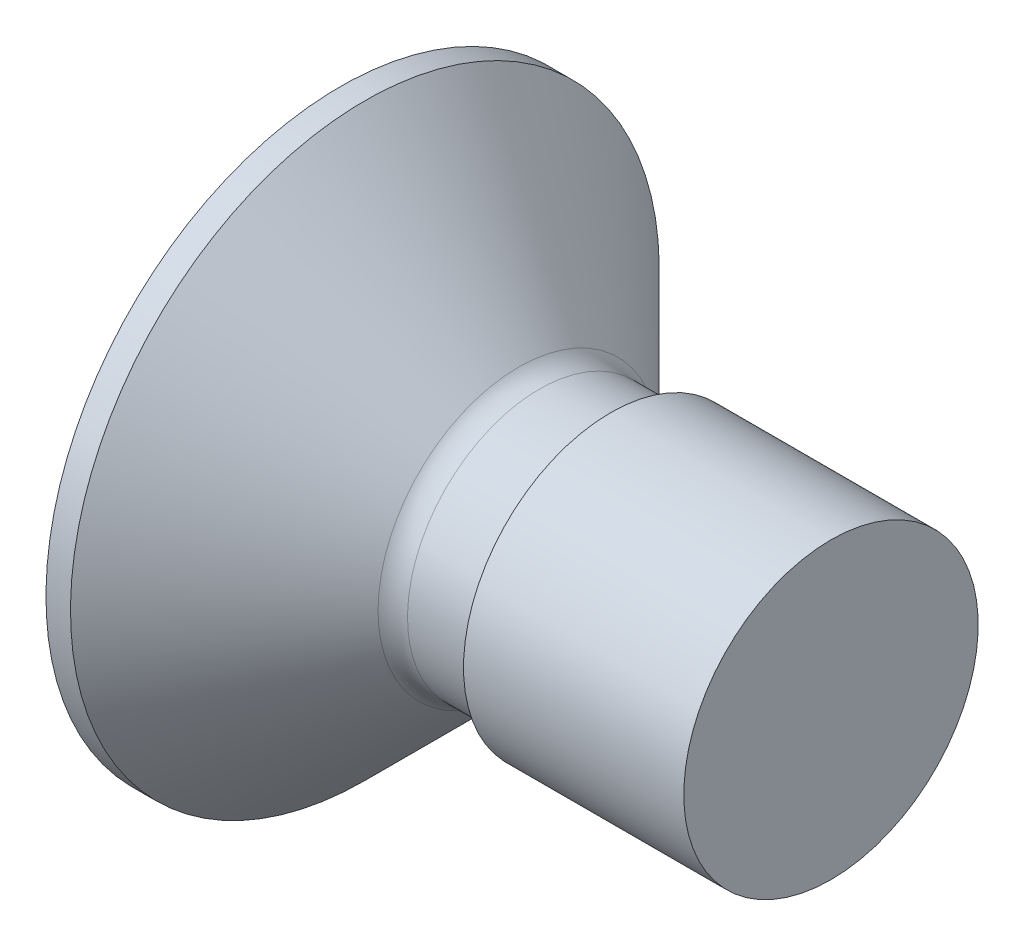
from build123d import *

# Parameters (mm, degrees)
FILLET1_R          = 0.3
CUT_EXTRUDE1_DEPTH = 0.88


with BuildPart() as part:
    # Sketch1 → Revolve1 (revolve)
    with BuildSketch(Plane.XY):
        Polygon((-1.75, 0), (-1.75, 3), (-1.5, 3), (0.155, 1.345), (1.005, 1.345), (1.005, 1.5), (3.25, 1.5), (3.25, 0), align=None)
    revolve(axis=Axis((-1.75, 0, 0), (1, 0, 0)))

    # Fillet1
    fillet1_edges = [part.edges().sort_by_distance(p)[0] for p in [
        (0.155, -1.345, 0),
    ]]
    fillet(fillet1_edges, radius=FILLET1_R)

    # Sketch2 → Cut-Extrude1 (cut)
    with BuildSketch(Plane.ZY.offset(1.75)):
        with BuildLine():
            Line((-0.4, 1.8), (0.4, 1.8))
            Line((0.4, 1.8), (0.4, 1))
            ThreePointArc((0.4, 1), (0.575735931, 0.575735931), (1, 0.4))
            Line((1, 0.4), (1.8, 0.4))
            Line((1.8, 0.4), (1.8, -0.4))
            Line((1.8, -0.4), (1, -0.4))
            ThreePointArc((1, -0.4), (0.575735931, -0.575735931), (0.4, -1))
            Line((0.4, -1), (0.4, -1.8))
            Line((0.4, -1.8), (-0.4, -1.8))
            Line((-0.4, -1.8), (-0.4, -1))
            ThreePointArc((-0.4, -1), (-0.575735931, -0.575735931), (-1, -0.4))
            Line((-1, -0.4), (-1.8, -0.4))
            Line((-1.8, -0.4), (-1.8, 0.4))
            Line((-1.8, 0.4), (-1, 0.4))
            ThreePointArc((-1, 0.4), (-0.575735931, 0.575735931), (-0.4, 1))
            Line((-0.4, 1), (-0.4, 1.8))
        make_face()
    extrude(amount=-CUT_EXTRUDE1_DEPTH, mode=Mode.SUBTRACT)


solid = part.part
